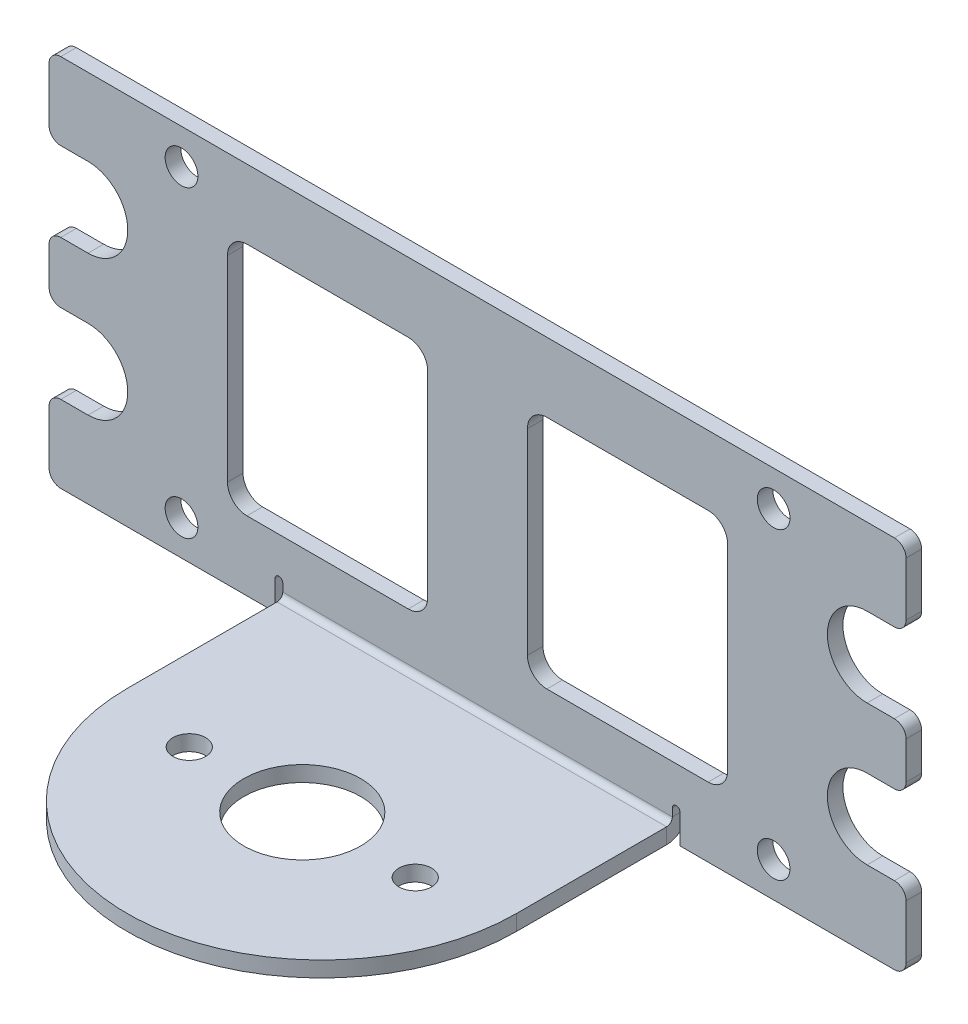
from build123d import *

# Parameters (mm, degrees)
SKETCH1_R                = 2.1
BASE_FLANGE1_DEPTH       = 2
EDGE_FLANGE1_START       = -3
EDGE_FLANGE1_DEPTH       = 3.7366
EDGE_FLANGE1_START_2     = 0.7366
EDGE_FLANGE1_2_OUTLINE_W = 50
EDGE_FLANGE1_2_OUTLINE_H = 2
EDGE_FLANGE1_2_DEPTH     = 44.2634
EDGE_FLANGE1_START_3     = -25
EDGE_FLANGE1_3_DEPTH     = 50
EDGE_FLANGE1_4_DEPTH     = 50
FILLET1_RADIUS           = 25
FILLET1_LENGTH           = 2
CUT_EXTRUDE1_REACH       = 86.652
SKETCH9_R                = 7.5
SKETCH9_R_2              = 2.1


with BuildPart() as part:
    # Base-Flange1: sheet metal written as solids
    # Sketch1 → Base-Flange1 (new body)
    with BuildSketch(Plane.XY):
        with BuildLine():
            Line((-53.5, -24), (53.5, -24))
            ThreePointArc((53.5, -24), (54.560660172, -23.560660172), (55, -22.5))
            Line((55, -22.5), (55, -15.6))
            ThreePointArc((55, -15.6), (54.560660172, -14.539339828), (53.5, -14.1))
            Line((53.5, -14.1), (50, -14.1))
            ThreePointArc((50, -14.1), (44.9, -9), (50, -3.9))
            Line((50, -3.9), (53.5, -3.9))
            ThreePointArc((53.5, -3.9), (54.560660172, -3.460660172), (55, -2.4))
            Line((55, -2.4), (55, 2.4))
            ThreePointArc((55, 2.4), (54.560660172, 3.460660172), (53.5, 3.9))
            Line((53.5, 3.9), (50, 3.9))
            ThreePointArc((50, 3.9), (44.9, 9), (50, 14.1))
            Line((50, 14.1), (53.5, 14.1))
            ThreePointArc((53.5, 14.1), (54.560660172, 14.539339828), (55, 15.6))
            Line((55, 15.6), (55, 22.5))
            ThreePointArc((55, 22.5), (54.560660172, 23.560660172), (53.5, 24))
            Line((53.5, 24), (-53.5, 24))
            ThreePointArc((-53.5, 24), (-54.560660172, 23.560660172), (-55, 22.5))
            Line((-55, 22.5), (-55, 15.6))
            ThreePointArc((-55, 15.6), (-54.560660172, 14.539339828), (-53.5, 14.1))
            Line((-53.5, 14.1), (-50, 14.1))
            ThreePointArc((-50, 14.1), (-44.9, 9), (-50, 3.9))
            Line((-50, 3.9), (-53.5, 3.9))
            ThreePointArc((-53.5, 3.9), (-54.560660172, 3.460660172), (-55, 2.4))
            Line((-55, 2.4), (-55, -2.4))
            ThreePointArc((-55, -2.4), (-54.560660172, -3.460660172), (-53.5, -3.9))
            Line((-53.5, -3.9), (-50, -3.9))
            ThreePointArc((-50, -3.9), (-44.9, -9), (-50, -14.1))
            Line((-50, -14.1), (-53.5, -14.1))
            ThreePointArc((-53.5, -14.1), (-54.560660172, -14.539339828), (-55, -15.6))
            Line((-55, -15.6), (-55, -22.5))
            ThreePointArc((-55, -22.5), (-54.560660172, -23.560660172), (-53.5, -24))
        make_face()
        with Locations((-38, 19.5)):
            Circle(SKETCH1_R, mode=Mode.SUBTRACT)
        with Locations((-38, -19.5)):
            Circle(SKETCH1_R, mode=Mode.SUBTRACT)
        with Locations((38, 19.5)):
            Circle(SKETCH1_R, mode=Mode.SUBTRACT)
        with Locations((38, -19.5)):
            Circle(SKETCH1_R, mode=Mode.SUBTRACT)
        with BuildLine():
            Line((6.4, 12.6), (6.4, -12.6))
            ThreePointArc((6.4, -12.6), (7.132233047, -14.367766953), (8.9, -15.1))
            Line((8.9, -15.1), (29.6, -15.1))
            ThreePointArc((29.6, -15.1), (31.367766953, -14.367766953), (32.1, -12.6))
            Line((32.1, -12.6), (32.1, 12.6))
            ThreePointArc((32.1, 12.6), (31.367766953, 14.367766953), (29.6, 15.1))
            Line((29.6, 15.1), (8.9, 15.1))
            ThreePointArc((8.9, 15.1), (7.132233047, 14.367766953), (6.4, 12.6))
        make_face(mode=Mode.SUBTRACT)
        with BuildLine():
            Line((-6.4, 12.6), (-6.4, -12.6))
            ThreePointArc((-6.4, -12.6), (-7.132233047, -14.367766953), (-8.9, -15.1))
            Line((-8.9, -15.1), (-29.6, -15.1))
            ThreePointArc((-29.6, -15.1), (-31.367766953, -14.367766953), (-32.1, -12.6))
            Line((-32.1, -12.6), (-32.1, 12.6))
            ThreePointArc((-32.1, 12.6), (-31.367766953, 14.367766953), (-29.6, 15.1))
            Line((-29.6, 15.1), (-8.9, 15.1))
            ThreePointArc((-8.9, 15.1), (-7.132233047, 14.367766953), (-6.4, 12.6))
        make_face(mode=Mode.SUBTRACT)
    extrude(amount=-BASE_FLANGE1_DEPTH)

    # Edge-Flange1: read off the stored shape, not the designer's step
    # Edge-Flange1 outline → Edge-Flange1 (cut)
    with BuildSketch(Plane.XY.offset(EDGE_FLANGE1_START)):
        with BuildLine():
            Line((-26, -24), (-25, -24))
            Line((-25, -24), (-25, -20.2634))
            ThreePointArc((-25, -20.2634), (-25.5, -19.7634), (-26, -20.2634))
            Line((-26, -20.2634), (-26, -24))
        make_face()
        with BuildLine():
            Line((25, -20.2634), (25, -24))
            Line((25, -24), (26, -24))
            Line((26, -24), (26, -20.2634))
            ThreePointArc((26, -20.2634), (25.5, -19.7634), (25, -20.2634))
        make_face()
    extrude(amount=EDGE_FLANGE1_DEPTH, mode=Mode.SUBTRACT)

    # Edge-Flange1 3 outline → Edge-Flange1 3 (cut)
    with BuildSketch(Plane.YZ.offset(EDGE_FLANGE1_START_3)):
        with BuildLine():
            ThreePointArc((-21.2634, -2), (-22.917667209, -1.443395312), (-23.899002398, 0))
            Line((-23.899002398, 0), (-24, 0))
            Line((-24, 0), (-24, -2))
            Line((-24, -2), (-21.2634, -2))
        make_face()
    extrude(amount=EDGE_FLANGE1_3_DEPTH, mode=Mode.SUBTRACT)



with BuildPart() as body_2:
    # Edge-Flange1 2 outline → Edge-Flange1 2 (new body)
    with BuildSketch(Plane.XY.offset(EDGE_FLANGE1_START_2)):
        with Locations((0, -23)):
            Rectangle(EDGE_FLANGE1_2_OUTLINE_W, EDGE_FLANGE1_2_OUTLINE_H)
    extrude(amount=EDGE_FLANGE1_2_DEPTH)


with BuildPart() as part_1:
    add(part.part)

    add(body_2.part)  # Edge-Flange1 4 merges body 2
    # Edge-Flange1 4 outline → Edge-Flange1 4 (add)
    with BuildSketch(Plane.YZ.offset(EDGE_FLANGE1_START_3)):
        with BuildLine():
            Line((-22, 0.7366), (-24, 0.7366))
            ThreePointArc((-24, 0.7366), (-23.974633029, 0.364854094), (-23.899002398, 0))
            Line((-23.899002398, 0), (-21.2634, 0))
            ThreePointArc((-21.2634, 0), (-21.784254855, 0.215745145), (-22, 0.7366))
        make_face()
    extrude(amount=EDGE_FLANGE1_4_DEPTH)

    # Fillet1: full round fillet: the end face becomes a half cylinder, R = half its width
    fillet1_face = Plane((0, -23, 45), x_dir=(0, -1, 0), z_dir=(0, 0, 1))  # on the end face: x along it, z out of the body
    fillet1_slab = fillet1_face.offset(-FILLET1_RADIUS / 2) * Box(FILLET1_LENGTH, 2 * FILLET1_RADIUS, FILLET1_RADIUS, mode=Mode.PRIVATE)  # the body's end, R deep
    fillet1_round = Plane((0, -23, 20), x_dir=(0, 0, 1), z_dir=(0, -1, 0)) * Cylinder(FILLET1_RADIUS, FILLET1_LENGTH, mode=Mode.PRIVATE)  # its axis R under the face
    add(fillet1_slab - fillet1_round, mode=Mode.SUBTRACT)

    # Sketch9 → Cut-Extrude1 (cut, up to next)
    with BuildSketch(Plane(origin=(0, -22, 0), x_dir=(1, 0, 0), z_dir=(0, 1, 0)), mode=Mode.PRIVATE) as cut_extrude1_sk1:
        with Locations(Location((0, -22.5, 0), (0, 0, 180))):
            Circle(SKETCH9_R)
    cut_extrude1_tool1 = extrude(cut_extrude1_sk1.sketch, amount=-CUT_EXTRUDE1_REACH, mode=Mode.PRIVATE) & part_1.part
    # Sketch9 → Cut-Extrude1 (cut, up to next)
    with BuildSketch(Plane(origin=(0, -22, 0), x_dir=(1, 0, 0), z_dir=(0, 1, 0)), mode=Mode.PRIVATE) as cut_extrude1_sk2:
        with Locations(Location((-14.5, -22.5, 0), (0, 0, 180))):
            Circle(SKETCH9_R_2)
    cut_extrude1_tool2 = extrude(cut_extrude1_sk2.sketch, amount=-CUT_EXTRUDE1_REACH, mode=Mode.PRIVATE) & part_1.part
    # Sketch9 → Cut-Extrude1 (cut, up to next)
    with BuildSketch(Plane(origin=(0, -22, 0), x_dir=(1, 0, 0), z_dir=(0, 1, 0)), mode=Mode.PRIVATE) as cut_extrude1_sk3:
        with Locations(Location((14.5, -22.5, 0), (0, 0, 180))):
            Circle(SKETCH9_R_2)
    cut_extrude1_tool3 = extrude(cut_extrude1_sk3.sketch, amount=-CUT_EXTRUDE1_REACH, mode=Mode.PRIVATE) & part_1.part
    add(cut_extrude1_tool1.solids().sort_by_distance((0, -22, 22.5))[0], mode=Mode.SUBTRACT)
    add(cut_extrude1_tool2.solids().sort_by_distance((-14.5, -22, 22.5))[0], mode=Mode.SUBTRACT)
    add(cut_extrude1_tool3.solids().sort_by_distance((14.5, -22, 22.5))[0], mode=Mode.SUBTRACT)


solid = part_1.part
